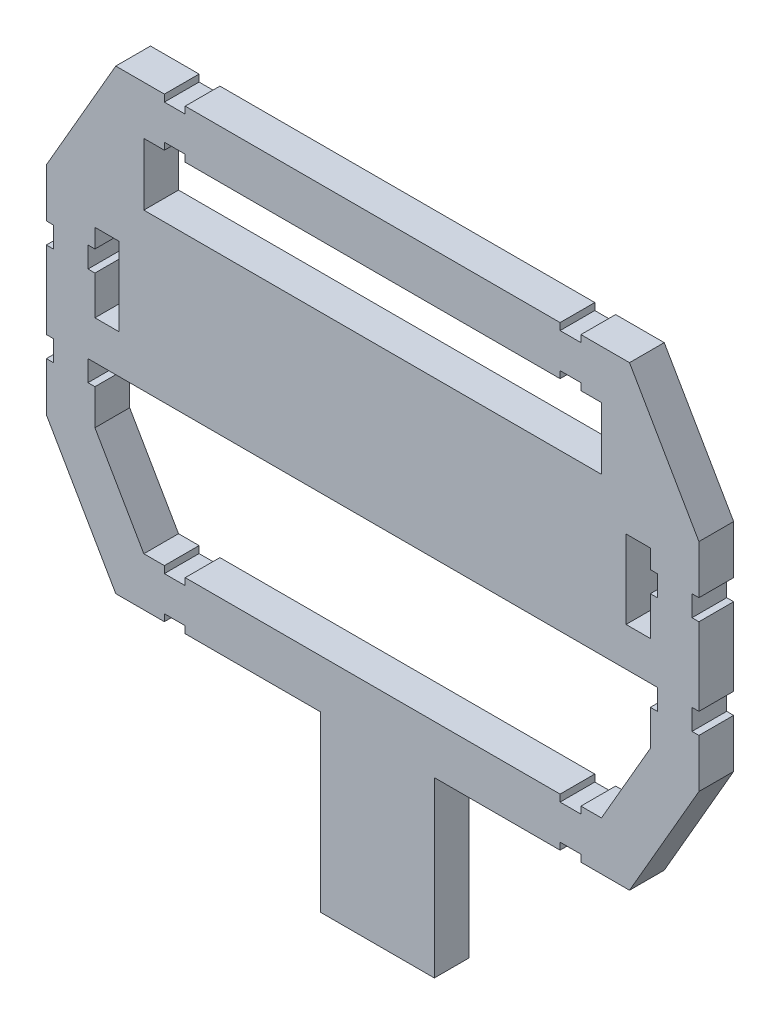
from build123d import *

# Parameters (mm, degrees)
BOSS_EXTRU_1_DEPTH = 5


with BuildPart() as part:
    # Esquisse1 → Boss.-Extru.1 (new body)
    with BuildSketch(Plane.XY):
        Polygon((-32, -29.022213998), (-32, -30.022213998), (-12.5, -30.022213998), (-12.5, -55.022213998), (3.886646309, -55.022213998), (3.886646309, -30.022213998), (22, -30.022213998), (22, -29.022213998), (25, -29.022213998), (25, -30.022213998), (32, -30.022213998), (42, -12.701705922), (42, -5.701705922), (41, -5.701705922), (41, -2.701705922), (42, -2.701705922), (42, 8.475208614), (41, 8.475208614), (41, 11.475208614), (42, 11.475208614), (42, 18.475208614), (32, 35.79571669), (25, 35.79571669), (25, 34.79571669), (22, 34.79571669), (22, 35.79571669), (-32, 35.79571669), (-32, 34.79571669), (-35, 34.79571669), (-35, 35.79571669), (-42, 35.79571669), (-52, 18.475208614), (-52, 11.475208614), (-51, 11.475208614), (-51, 8.475208614), (-52, 8.475208614), (-52, -2.701705922), (-51, -2.701705922), (-51, -5.701705922), (-52, -5.701705922), (-52, -12.701705922), (-42, -30.022213998), (-35, -30.022213998), (-35, -29.022213998), align=None)
        Polygon((-46, -2.701705922), (-45, -2.701705922), (35, -2.701705922), (36, -2.701705922), (36, -5.701705922), (35, -5.701705922), (35, -10.826061575), (27.958548116, -23.022213998), (25, -23.022213998), (25, -24.022213998), (22, -24.022213998), (22, -23.022213998), (-32, -23.022213998), (-32, -24.022213998), (-35, -24.022213998), (-35, -23.022213998), (-37.958548116, -23.022213998), (-45, -10.826061575), (-45, -5.701705922), (-46, -5.701705922), align=None, mode=Mode.SUBTRACT)
        Polygon((-45, 2.886751346), (-45, 8.475208614), (-46, 8.475208614), (-46, 11.475208614), (-45, 11.475208614), (-45, 14.177208614), (-41.5, 14.177208614), (-41.5, 2.886751346), align=None, mode=Mode.SUBTRACT)
        Polygon((-32, 29.79571669), (-32, 28.79571669), (22, 28.79571669), (22, 29.79571669), (25, 29.79571669), (25, 28.79571669), (27.958548116, 28.79571669), (27.958548116, 19.842608257), (-37.958548116, 19.842608257), (-37.958548116, 28.79571669), (-35, 28.79571669), (-35, 29.79571669), align=None, mode=Mode.SUBTRACT)
        Polygon((35, 8.475208614), (35, 2.886751346), (31.5, 2.886751346), (31.5, 14.177208614), (35, 14.177208614), (35, 11.475208614), (36, 11.475208614), (36, 8.475208614), align=None, mode=Mode.SUBTRACT)
    extrude(amount=BOSS_EXTRU_1_DEPTH)


solid = part.part
